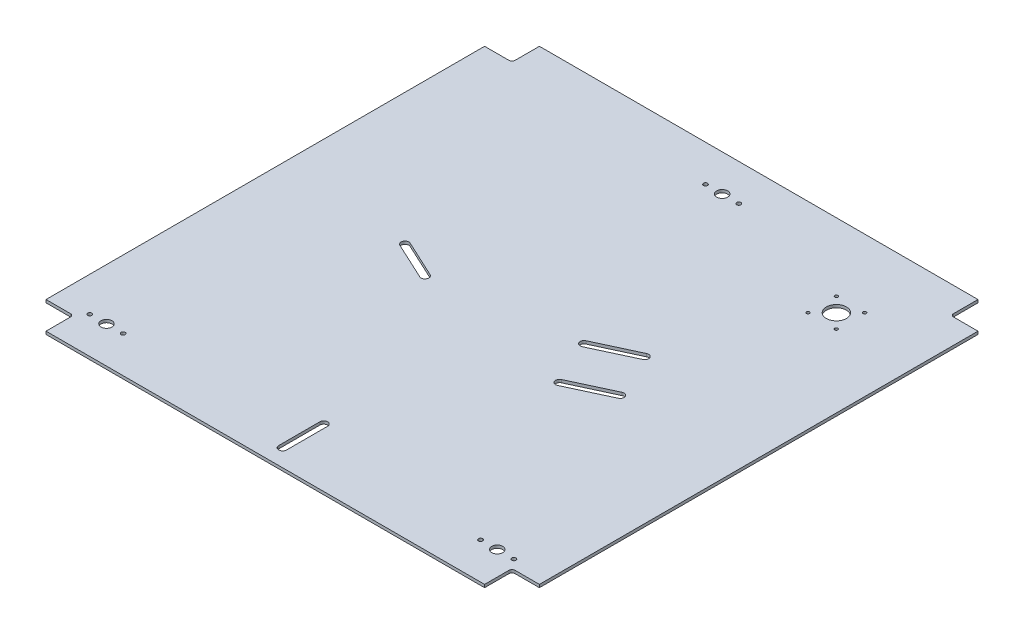
from build123d import *

# Parameters (mm, degrees)
SKETCH2_W             = 540
SKETCH2_H             = 540
SKETCH2_R             = 6
SKETCH2_R_2           = 11
BOSS_EXTRUDE1_DEPTH   = 3.175
M4_CLEARANCE_HOLE1_D  = 4.5
M3_CLEARANCE_HOLE10_D = 3.4
SKETCH5_W             = 30
SKETCH5_H             = 30
CUT_EXTRUDE1_DEPTH    = 764.681923725
FILLET1_R             = 3.175
CUT_EXTRUDE2_DEPTH    = 764.681923725
CUT_EXTRUDE3_DEPTH    = 764.681923725


with BuildPart() as part:
    # Sketch2 → Boss-Extrude1 (new body)
    with BuildSketch(Plane(origin=(0, 0, 0), x_dir=(1, 0, 0), z_dir=(0, 1, 0))):
        with Locations((270, 270)):
            Rectangle(SKETCH2_W, SKETCH2_H)
        with Locations((56.175, 40)):
            Circle(SKETCH2_R, mode=Mode.SUBTRACT)
        with Locations((483.825, 40)):
            Circle(SKETCH2_R, mode=Mode.SUBTRACT)
        with Locations((270, 500)):
            Circle(SKETCH2_R, mode=Mode.SUBTRACT)
        with Locations((445, 450)):
            Circle(SKETCH2_R_2, mode=Mode.SUBTRACT)
    extrude(amount=BOSS_EXTRUDE1_DEPTH)

    # M4 Clearance Hole1 (through all)
    with Locations(Plane(origin=(74.425, 3.175, -40), x_dir=(0, 0, 1), z_dir=(0, 1, 0))):
        with Locations((0, 0), (0, -36.5), (-460, 177.325), (-460, 213.825), (0, 391.15), (0, 427.65)):
            Hole(M4_CLEARANCE_HOLE1_D / 2)

    # M3 Clearance Hole10 (through all)
    with Locations(Plane(origin=(429.5, 3.175, -465.5), x_dir=(0, 0, 1), z_dir=(0, 1, 0))):
        with Locations((0, 0), (0, 31), (31, 31), (31, 0)):
            Hole(M3_CLEARANCE_HOLE10_D / 2)

    # Sketch5 → Cut-Extrude1 (cut, through all)
    with BuildSketch(Plane(origin=(0, 3.175, 0), x_dir=(1, 0, 0), z_dir=(0, 1, 0))):
        with Locations((15, 15)):
            Rectangle(SKETCH5_W, SKETCH5_H)
        with Locations((525, 15)):
            Rectangle(SKETCH5_W, SKETCH5_H)
        with Locations((525, 525)):
            Rectangle(SKETCH5_W, SKETCH5_H)
        with Locations((15, 525)):
            Rectangle(SKETCH5_W, SKETCH5_H)
    extrude(amount=-CUT_EXTRUDE1_DEPTH, mode=Mode.SUBTRACT)

    # Fillet1
    fillet1_edges = [part.edges().sort_by_distance(p)[0] for p in [
        (30, 1.5875, -510),
        (510, 1.5875, -510),
        (510, 1.5875, -30),
        (30, 1.5875, -30),
    ]]
    fillet(fillet1_edges, radius=FILLET1_R)

    # Sketch6 → Cut-Extrude2 (cut, through all)
    with BuildSketch(Plane(origin=(0, 3.175, 0), x_dir=(1, 0, 0), z_dir=(0, 1, 0))):
        with BuildLine():
            Line((379.893699129, 307.475094097), (334.552801834, 286.398969393))
            ThreePointArc((334.552801834, 286.398969393), (332.490296164, 280.753522523), (338.135743034, 278.691016853))
            Line((338.135743034, 278.691016853), (383.476640328, 299.767141557))
            ThreePointArc((383.476640328, 299.767141557), (385.539145999, 305.412588427), (379.893699129, 307.475094097))
        make_face()
        with BuildLine():
            Line((403.216635284, 257.300649427), (357.87573799, 236.224524722))
            ThreePointArc((357.87573799, 236.224524722), (355.81323232, 230.579077853), (361.45867919, 228.516572182))
            Line((361.45867919, 228.516572182), (406.799576484, 249.592696887))
            ThreePointArc((406.799576484, 249.592696887), (408.862082154, 255.238143756), (403.216635284, 257.300649427))
        make_face()
    extrude(amount=-CUT_EXTRUDE2_DEPTH, mode=Mode.SUBTRACT)

    # Sketch9 → Cut-Extrude3 (cut, through all)
    with BuildSketch(Plane(origin=(0, 3.175, 0), x_dir=(1, 0, 0), z_dir=(0, 1, 0))):
        with BuildLine():
            Line((274.25, 19), (274.25, 64))
            ThreePointArc((274.25, 64), (270, 68.25), (265.75, 64))
            Line((265.75, 64), (265.75, 19))
            ThreePointArc((265.75, 19), (270, 14.75), (274.25, 19))
        make_face()
        with BuildLine():
            Line((186.642601301, 263.737436412), (145.835793736, 282.705948646))
            ThreePointArc((145.835793736, 282.705948646), (140.190346866, 280.643442976), (142.252852537, 274.997996106))
            Line((142.252852537, 274.997996106), (183.059660101, 256.029483872))
            ThreePointArc((183.059660101, 256.029483872), (188.705106971, 258.091989542), (186.642601301, 263.737436412))
        make_face()
    extrude(amount=-CUT_EXTRUDE3_DEPTH, mode=Mode.SUBTRACT)


solid = part.part
